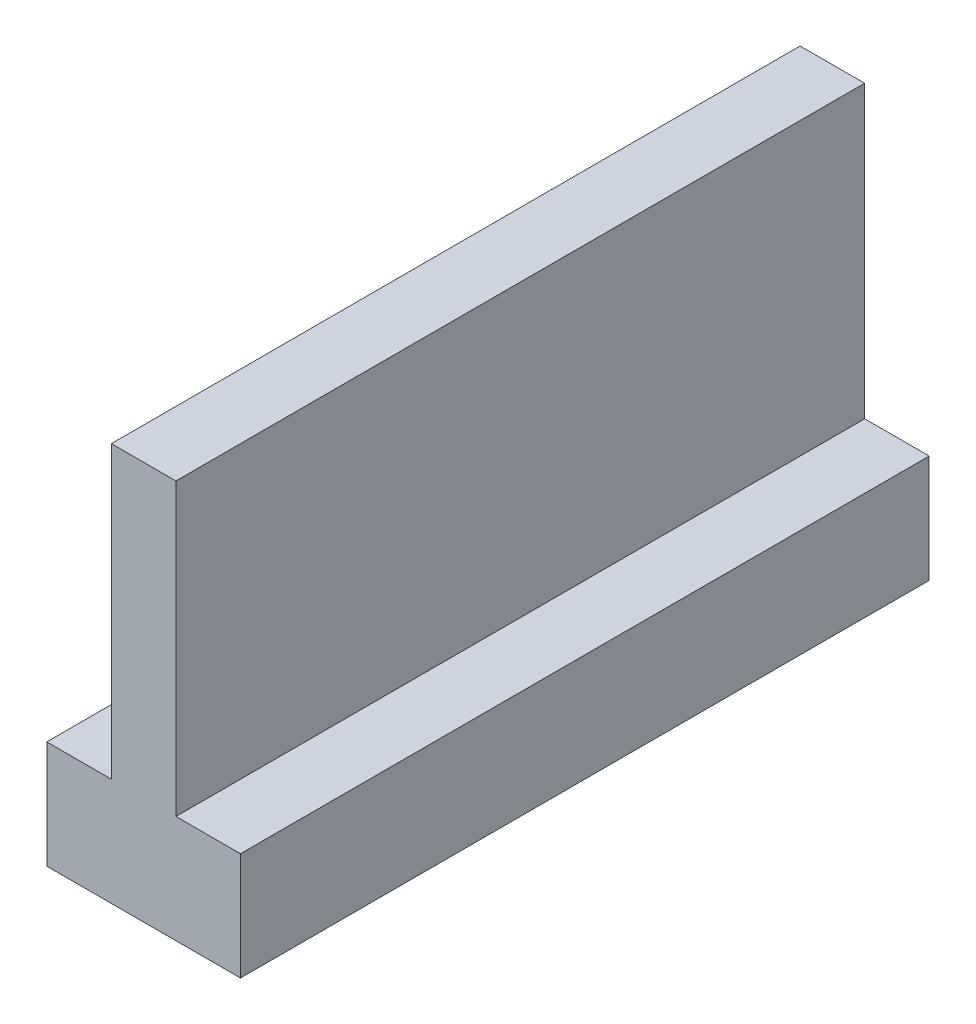
from build123d import *

# Parameters (mm, degrees)
BOSS_EXTRUDE2_DEPTH = 64


with BuildPart() as part:
    # Sketch2 → Boss-Extrude2 (new body)
    with BuildSketch(Plane.XY):
        Polygon((0, 0), (0, 10), (6, 10), (6, 37), (12, 37), (12, 10), (18, 10), (18, 0), align=None)
    extrude(amount=BOSS_EXTRUDE2_DEPTH)


solid = part.part
